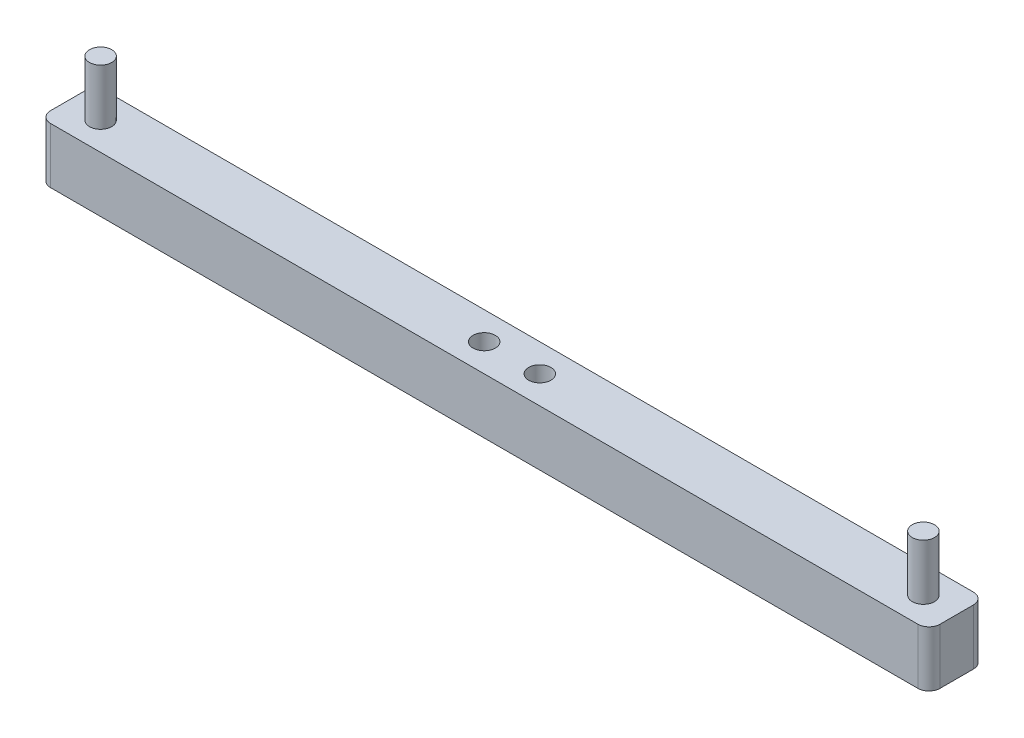
from build123d import *

# Parameters (mm, degrees)
SKETCH1_W           = 80
SKETCH1_H           = 5
BOSS_EXTRUDE1_DEPTH = 5
FILLET1_R           = 1
FILLET2_R           = 1
SKETCH2_R           = 1
CUT_EXTRUDE1_DEPTH  = 41.388736054
SKETCH2_3_R         = 1
BOSS_EXTRUDE2_DEPTH = 5


with BuildPart() as part:
    # Sketch1 → Boss-Extrude1 (new body)
    with BuildSketch(Plane(origin=(0, 0, 0), x_dir=(1, 0, 0), z_dir=(0, 1, 0))):
        Rectangle(SKETCH1_W, SKETCH1_H)
    extrude(amount=BOSS_EXTRUDE1_DEPTH)

    # Fillet1
    fillet1_edges = [part.edges().sort_by_distance(p)[0] for p in [
        (-40, 2.5, -2.5),
        (-40, 2.5, 2.5),
    ]]
    fillet(fillet1_edges, radius=FILLET1_R)

    # Fillet2
    fillet2_edges = [part.edges().sort_by_distance(p)[0] for p in [
        (40, 2.5, -2.5),
        (40, 2.5, 2.5),
    ]]
    fillet(fillet2_edges, radius=FILLET2_R)

    # Sketch2 → Cut-Extrude1 (cut, through all)
    with BuildSketch(Plane(origin=(0, 5, 0), x_dir=(1, 0, 0), z_dir=(0, 1, 0))):
        with Locations((-2.5, 0)):
            Circle(SKETCH2_R)
        with Locations((2.5, 0)):
            Circle(SKETCH2_R)
    extrude(amount=-CUT_EXTRUDE1_DEPTH, mode=Mode.SUBTRACT)

    # Sketch2<3> → Boss-Extrude2 (add)
    with BuildSketch(Plane(origin=(0, 5, 0), x_dir=(1, 0, 0), z_dir=(0, 1, 0))):
        with Locations((-37, 0)):
            Circle(SKETCH2_3_R)
        with Locations((37, 0)):
            Circle(SKETCH2_3_R)
    extrude(amount=BOSS_EXTRUDE2_DEPTH)


solid = part.part
